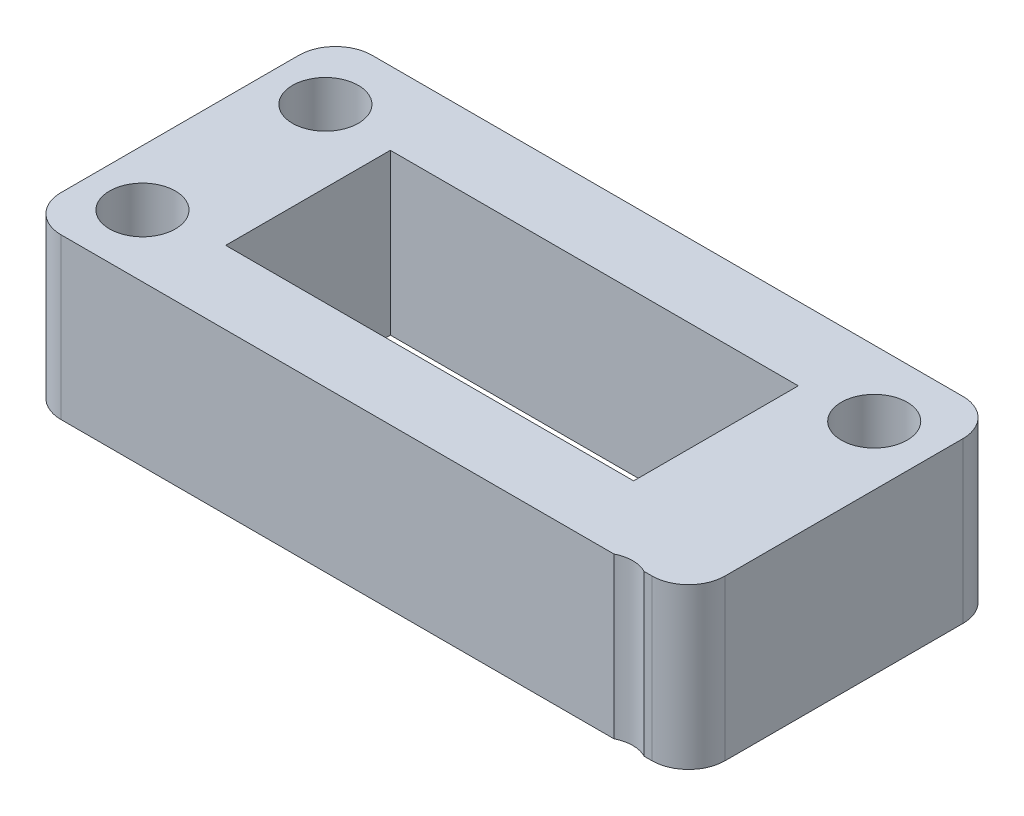
from build123d import *

# Parameters (mm, degrees)
SKETCH1_W            = 36.3
SKETCH1_H            = 17
SKETCH1_W_2          = 22.3
SKETCH1_H_2          = 9
BOSS_EXTRUDE1_DEPTH  = 8.75
M3_CLEARANCE_HOLE1_D = 3.6
FILLET1_R            = 2


with BuildPart() as part:
    # Sketch1 → Boss-Extrude1 (new body)
    with BuildSketch(Plane(origin=(0, 0, 0), x_dir=(1, 0, 0), z_dir=(0, 1, 0))):
        with Locations((18.15, 8.5)):
            Rectangle(SKETCH1_W, SKETCH1_H)
        with Locations((18.15, 8.5)):
            Rectangle(SKETCH1_W_2, SKETCH1_H_2, mode=Mode.SUBTRACT)
    extrude(amount=BOSS_EXTRUDE1_DEPTH)

    # M3 Clearance Hole1 (through all)
    with Locations(Plane(origin=(0, 8.75, 0), x_dir=(1, 0, 0), z_dir=(0, 1, 0))):
        with Locations((3.050005002, 3.4), (33.050005002, -1.6), (33.050005002, 13.4), (3.050005002, 13.4)):
            Hole(M3_CLEARANCE_HOLE1_D / 2)

    # Fillet1
    fillet1_edges = [part.edges().sort_by_distance(p)[0] for p in [
        (0, 4.375, -17),
        (36.3, 4.375, -17),
        (36.3, 4.375, 0),
        (0, 4.375, 0),
    ]]
    fillet(fillet1_edges, radius=FILLET1_R)


solid = part.part
